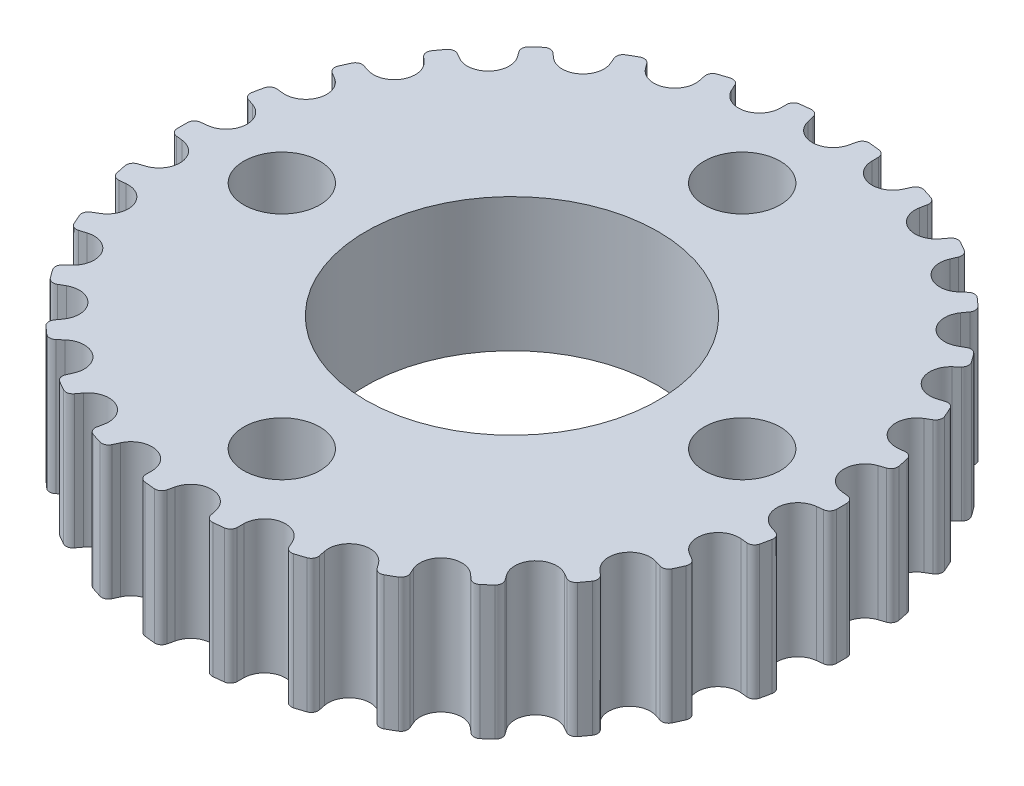
from build123d import *

# Parameters (mm, degrees)
SKETCH1_R           = 14.323944878
BOSS_EXTRUDE1_DEPTH = 5.8
CUT_EXTRUDE1_DEPTH  = 22.07108905
CIRPATTERN1_COUNT   = 30
SKETCH3_R           = 6.35
CUT_EXTRUDE2_DEPTH  = 22.033616305
SKETCH4_R           = 1.65
CUT_EXTRUDE3_DEPTH  = 22.033616305


with BuildPart() as part:
    # Sketch1 → Boss-Extrude1 (new body)
    with BuildSketch(Plane(origin=(0, 0, 0), x_dir=(1, 0, 0), z_dir=(0, 1, 0))):
        Circle(SKETCH1_R)
    extrude(amount=BOSS_EXTRUDE1_DEPTH)

    # Sketch2 → Cut-Extrude1 (cut, through all)
    with BuildSketch(Plane(origin=(0, 5.8, 0), x_dir=(1, 0, 0), z_dir=(0, 1, 0))):
        with BuildLine():
            Line((-0.88830444, 13.756422166), (-0.95, 14.033881093))
            ThreePointArc((-0.95, 14.033881093), (-1.065709647, 14.210883809), (-1.269434594, 14.267583281))
            ThreePointArc((-1.269434594, 14.267583281), (-2.127648488, 14.165045315), (-2.978115599, 14.010932316))
            Line((-2.978115599, 14.010932316), (-2.978115599, 14.323944878))
            Line((-2.978115599, 14.323944878), (2.978115599, 14.323944878))
            Line((2.978115599, 14.323944878), (2.978115599, 14.010932316))
            ThreePointArc((2.978115599, 14.010932316), (2.127648488, 14.165045315), (1.269434594, 14.267583281))
            ThreePointArc((1.269434594, 14.267583281), (1.065709647, 14.210883809), (0.95, 14.033881093))
            Line((0.95, 14.033881093), (0.88830444, 13.756422166))
            ThreePointArc((0.88830444, 13.756422166), (0, 13.043944878), (-0.88830444, 13.756422166))
        make_face()
    cut_extrude1 = extrude(amount=-CUT_EXTRUDE1_DEPTH, mode=Mode.SUBTRACT)

    # CirPattern1: Cut-Extrude1 ×30 about axis
    cirpattern1_axis = Axis((0, 5.8, 0), (0, -1, 0))
    for i in range(1, CIRPATTERN1_COUNT):
        add(cut_extrude1.rotate(cirpattern1_axis, i * 360 / CIRPATTERN1_COUNT), mode=Mode.SUBTRACT)

    # Sketch3 → Cut-Extrude2 (cut, through all)
    with BuildSketch(Plane.XZ):
        Circle(SKETCH3_R)
    extrude(amount=-CUT_EXTRUDE2_DEPTH, mode=Mode.SUBTRACT)

    # Sketch4 → Cut-Extrude3 (cut, through all)
    with BuildSketch(Plane.XZ):
        with Locations((0, 10)):
            Circle(SKETCH4_R)
        with Locations((10, 0)):
            Circle(SKETCH4_R)
        with Locations((0, -10)):
            Circle(SKETCH4_R)
        with Locations((-10, 0)):
            Circle(SKETCH4_R)
    extrude(amount=-CUT_EXTRUDE3_DEPTH, mode=Mode.SUBTRACT)


solid = part.part
